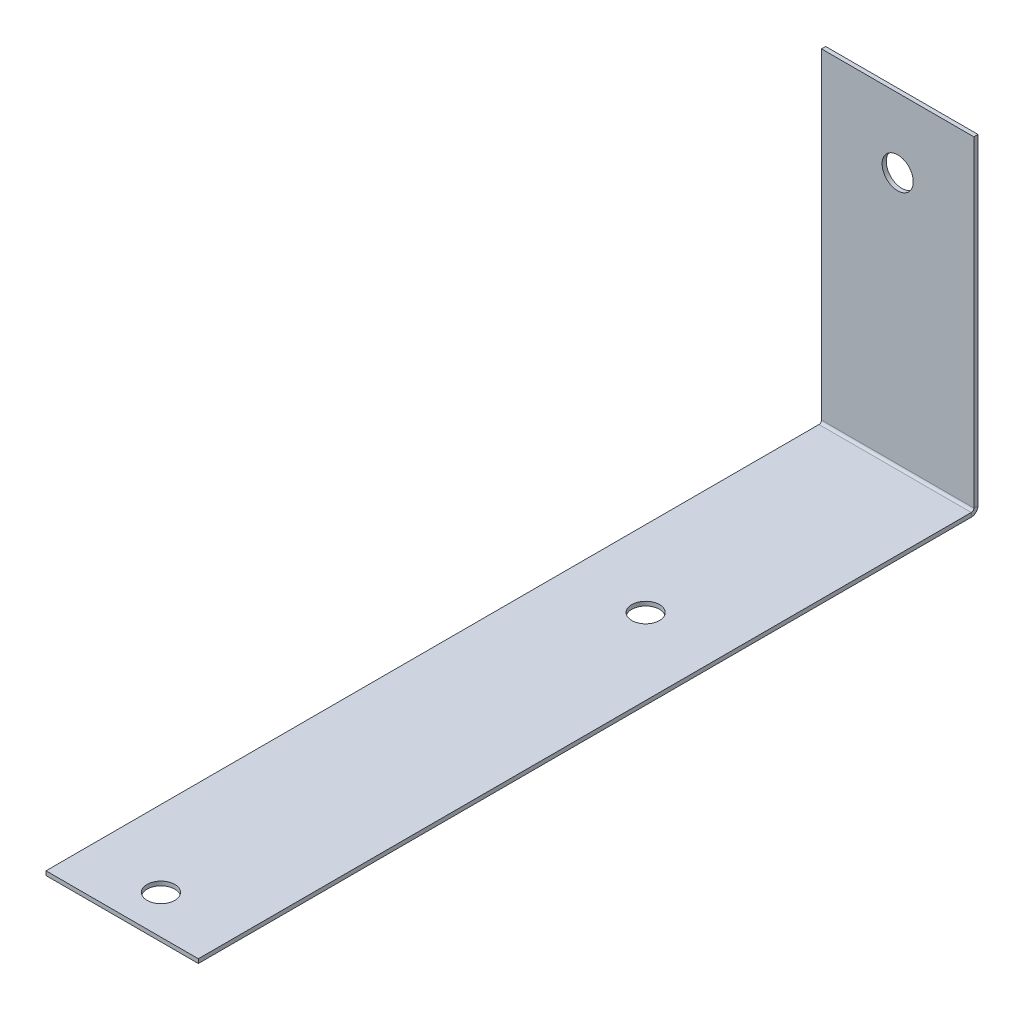
from build123d import *

# Parameters (mm, degrees)
SKETCH1_W              = 44
SKETCH1_H              = 320
BASE_FLANGE1_DEPTH     = 1.2
SKETCHED_START         = -22
SKETCHED_BEND1_DEPTH   = 44
SKETCHED_BEND1_2_DEPTH = 44
SKETCH7_R              = 4.5
CUT_EXTRUDE1_DEPTH     = 10
SKETCH8_R              = 4
CUT_EXTRUDE2_DEPTH     = 10


# Read off the part's stored shape, not the designer's step: Sketched Bend1
# Sheet-metal steps are written as plain solids
with BuildPart() as part:
    # Sketch1 → Base-Flange1 (new body)
    with BuildSketch(Plane(origin=(0, 0, 0), x_dir=(1, 0, 0), z_dir=(0, 1, 0))):
        Rectangle(SKETCH1_W, SKETCH1_H)
    extrude(amount=-BASE_FLANGE1_DEPTH)

    # Sketched Bend1 outline → Sketched Bend1 (cut)
    with BuildSketch(Plane.YZ.offset(SKETCHED_START)):
        with BuildLine():
            Line((0, -160), (0, -65.054444388))
            ThreePointArc((0, -65.054444388), (-0.872269031, -64.341342484), (-1.2, -63.2634))
            Line((-1.2, -63.2634), (-1.2, -160))
            Line((-1.2, -160), (0, -160))
        make_face()
    extrude(amount=SKETCHED_BEND1_DEPTH, mode=Mode.SUBTRACT)

    # Sketched Bend1 2 outline → Sketched Bend1 2 (add)
    with BuildSketch(Plane.YZ.offset(SKETCHED_START)):
        with BuildLine():
            Line((93.6, -64), (0.7366, -64))
            ThreePointArc((0.7366, -64), (0.215745145, -63.784254855), (0, -63.2634))
            Line((0, -63.2634), (0, -65.054444388))
            ThreePointArc((0, -65.054444388), (0.361178238, -65.163262642), (0.7366, -65.2))
            Line((0.7366, -65.2), (93.6, -65.2))
            Line((93.6, -65.2), (93.6, -64))
        make_face()
    extrude(amount=SKETCHED_BEND1_2_DEPTH)

    # Sketch7 → Cut-Extrude1 (cut)
    with BuildSketch(Plane(origin=(0, 0, -65.2), x_dir=(-1, 0, 0), z_dir=(0, 0, -1))):
        with Locations(Location((0, 73.6, 0), (0, 0, 90))):
            Circle(SKETCH7_R)
    extrude(amount=-CUT_EXTRUDE1_DEPTH, mode=Mode.SUBTRACT)

    # Sketch8 → Cut-Extrude2 (cut)
    with BuildSketch(Plane.XZ.offset(1.2)):
        with Locations(Location((0, 8.8, 0), (0, 0, 270))):
            Circle(SKETCH8_R)
        with Locations(Location((0, 148.8, 0), (0, 0, 270))):
            Circle(SKETCH8_R)
    extrude(amount=-CUT_EXTRUDE2_DEPTH, mode=Mode.SUBTRACT)


solid = part.part
